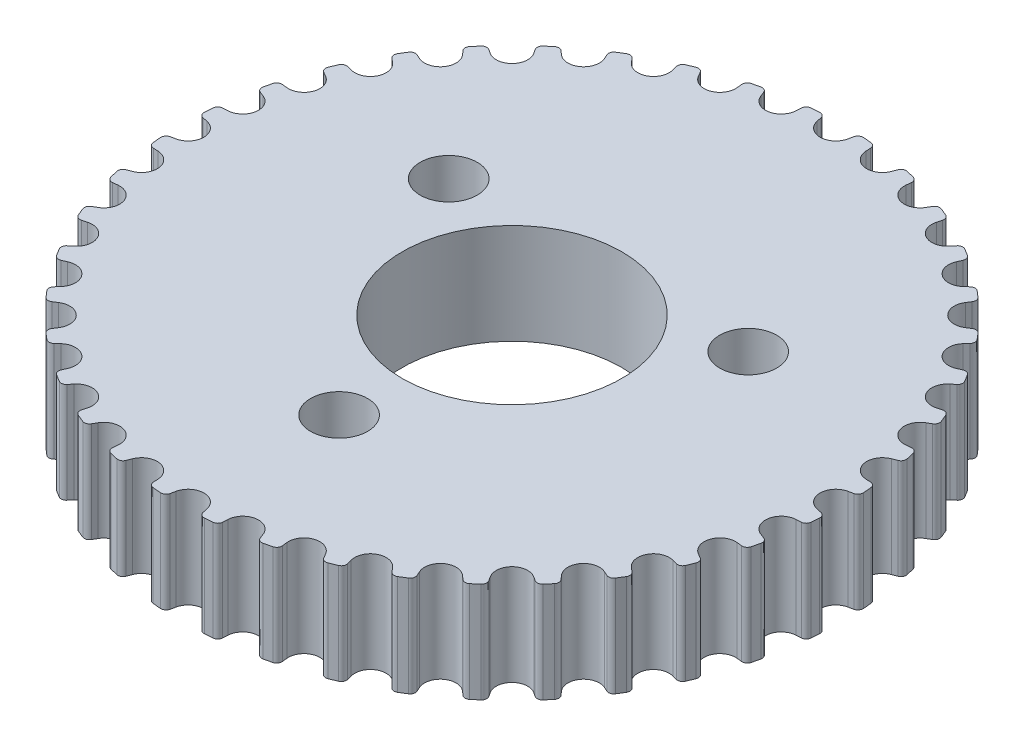
from build123d import *

# Parameters (mm, degrees)
SKETCH1_R           = 19.098593171
BOSS_EXTRUDE1_DEPTH = 5.8
CUT_EXTRUDE1_DEPTH  = 28.625215334
CIRPATTERN1_COUNT   = 40
SKETCH3_R           = 6.35
CUT_EXTRUDE2_DEPTH  = 28.568298151
SKETCH4_R           = 1.65
CUT_EXTRUDE3_DEPTH  = 28.568298151


with BuildPart() as part:
    # Sketch1 → Boss-Extrude1 (new body)
    with BuildSketch(Plane(origin=(0, 0, 0), x_dir=(1, 0, 0), z_dir=(0, 1, 0))):
        Circle(SKETCH1_R)
    extrude(amount=BOSS_EXTRUDE1_DEPTH)

    # Sketch2 → Cut-Extrude1 (cut, through all)
    with BuildSketch(Plane(origin=(0, 5.8, 0), x_dir=(1, 0, 0), z_dir=(0, 1, 0))):
        with BuildLine():
            Line((-0.889963519, 18.53868547), (-0.95, 18.820034134))
            ThreePointArc((-0.95, 18.820034134), (-1.062511657, 18.996762473), (-1.263237454, 19.056770247))
            ThreePointArc((-1.263237454, 19.056770247), (-2.127654439, 18.979708841), (-2.987678206, 18.863457797))
            Line((-2.987678206, 18.863457797), (-2.987678206, 19.098593171))
            Line((-2.987678206, 19.098593171), (2.987678206, 19.098593171))
            Line((2.987678206, 19.098593171), (2.987678206, 18.863457797))
            ThreePointArc((2.987678206, 18.863457797), (2.127654439, 18.979708841), (1.263237454, 19.056770247))
            ThreePointArc((1.263237454, 19.056770247), (1.062511657, 18.996762473), (0.95, 18.820034134))
            Line((0.95, 18.820034134), (0.889963519, 18.53868547))
            ThreePointArc((0.889963519, 18.53868547), (0, 17.818593171), (-0.889963519, 18.53868547))
        make_face()
    cut_extrude1 = extrude(amount=-CUT_EXTRUDE1_DEPTH, mode=Mode.SUBTRACT)

    # CirPattern1: Cut-Extrude1 ×40 about axis
    cirpattern1_axis = Axis((0, 5.8, 0), (0, -1, 0))
    for i in range(1, CIRPATTERN1_COUNT):
        add(cut_extrude1.rotate(cirpattern1_axis, i * 360 / CIRPATTERN1_COUNT), mode=Mode.SUBTRACT)

    # Sketch3 → Cut-Extrude2 (cut, through all)
    with BuildSketch(Plane.XZ):
        Circle(SKETCH3_R)
    extrude(amount=-CUT_EXTRUDE2_DEPTH, mode=Mode.SUBTRACT)

    # Sketch4 → Cut-Extrude3 (cut, through all)
    with BuildSketch(Plane.XZ):
        with Locations((0, 10)):
            Circle(SKETCH4_R)
        with Locations((8.660254038, -5)):
            Circle(SKETCH4_R)
        with Locations((-8.660254038, -5)):
            Circle(SKETCH4_R)
    extrude(amount=-CUT_EXTRUDE3_DEPTH, mode=Mode.SUBTRACT)


solid = part.part
